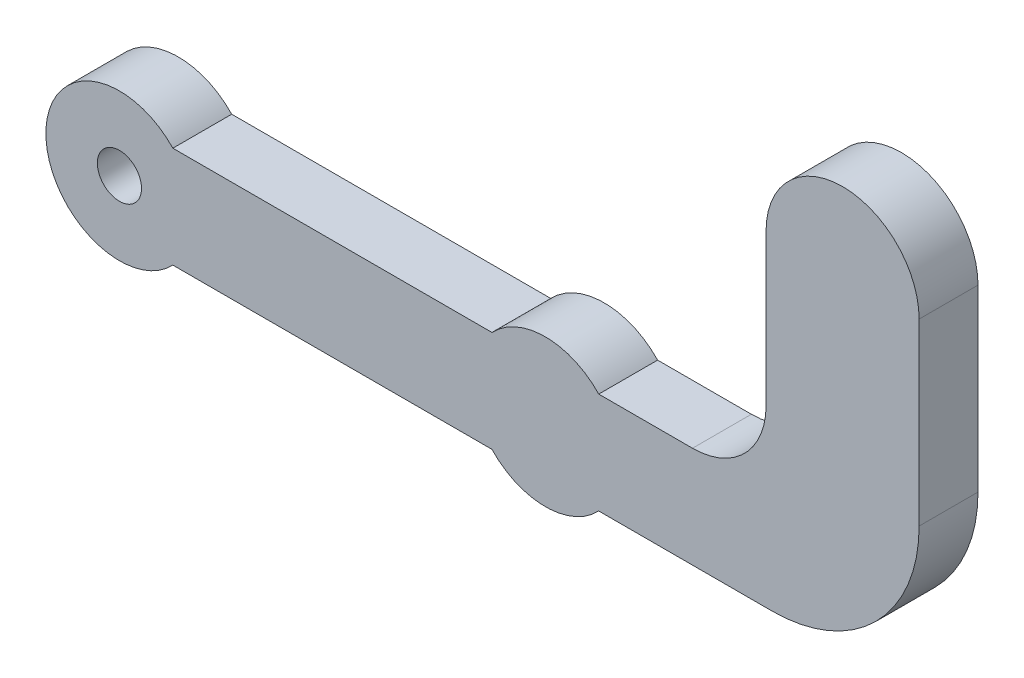
from build123d import *

# Parameters (mm, degrees)
CROQUIS1_R              = 1.5
SALIENTE_EXTRUIR1_DEPTH = 4
SALIENTE_EXTRUIR2_START = -1
CROQUIS2_R              = 1.5
SALIENTE_EXTRUIR2_DEPTH = 1


with BuildPart() as part:
    # Croquis1 → Saliente-Extruir1 (new body)
    with BuildSketch(Plane.XY):
        with BuildLine():
            Line((39.995922813, -13.960123785), (33.624476244, -13.960123785))
            ThreePointArc((33.624476244, -13.960123785), (29.995922813, -12.400123785), (26.367369382, -13.960123785))
            Line((26.367369382, -13.960123785), (4.684476244, -13.960123785))
            ThreePointArc((4.684476244, -13.960123785), (-3.944077187, -17.400123785), (4.684476244, -20.840123785))
            Line((4.684476244, -20.840123785), (26.367369382, -20.840123785))
            ThreePointArc((26.367369382, -20.840123785), (29.995922813, -22.400123785), (33.624476244, -20.840123785))
            Line((33.624476244, -20.840123785), (45.395922813, -20.840123785))
            ThreePointArc((45.395922813, -20.840123785), (52.466990625, -17.911191597), (55.395922813, -10.840123785))
            Line((55.395922813, -10.840123785), (55.395922813, 1.339876215))
            ThreePointArc((55.395922813, 1.339876215), (50.195922813, 6.539876215), (44.995922813, 1.339876215))
            Line((44.995922813, 1.339876215), (44.995922813, -8.960123785))
            ThreePointArc((44.995922813, -8.960123785), (43.531456719, -12.495657691), (39.995922813, -13.960123785))
        make_face()
        with Locations((50.395922813, -9.140123785)):
            Circle(CROQUIS1_R, mode=Mode.SUBTRACT)
        with Locations((50.395922813, 1.339876215)):
            Circle(CROQUIS1_R, mode=Mode.SUBTRACT)
        with Locations((29.995922813, -17.400123785)):
            Circle(CROQUIS1_R, mode=Mode.SUBTRACT)
        with Locations((1.055922813, -17.400123785)):
            Circle(CROQUIS1_R, mode=Mode.SUBTRACT)
    extrude(amount=SALIENTE_EXTRUIR1_DEPTH)

    # Croquis2 → Saliente-Extruir2 (add)
    with BuildSketch(Plane.XY.offset(4).offset(SALIENTE_EXTRUIR2_START)):
        with Locations((50.395922813, 1.339876215)):
            Circle(CROQUIS2_R)
        with Locations((50.395922813, -9.140123785)):
            Circle(CROQUIS2_R)
        with Locations((29.995922813, -17.400123785)):
            Circle(CROQUIS2_R)
    extrude(amount=SALIENTE_EXTRUIR2_DEPTH)


solid = part.part
